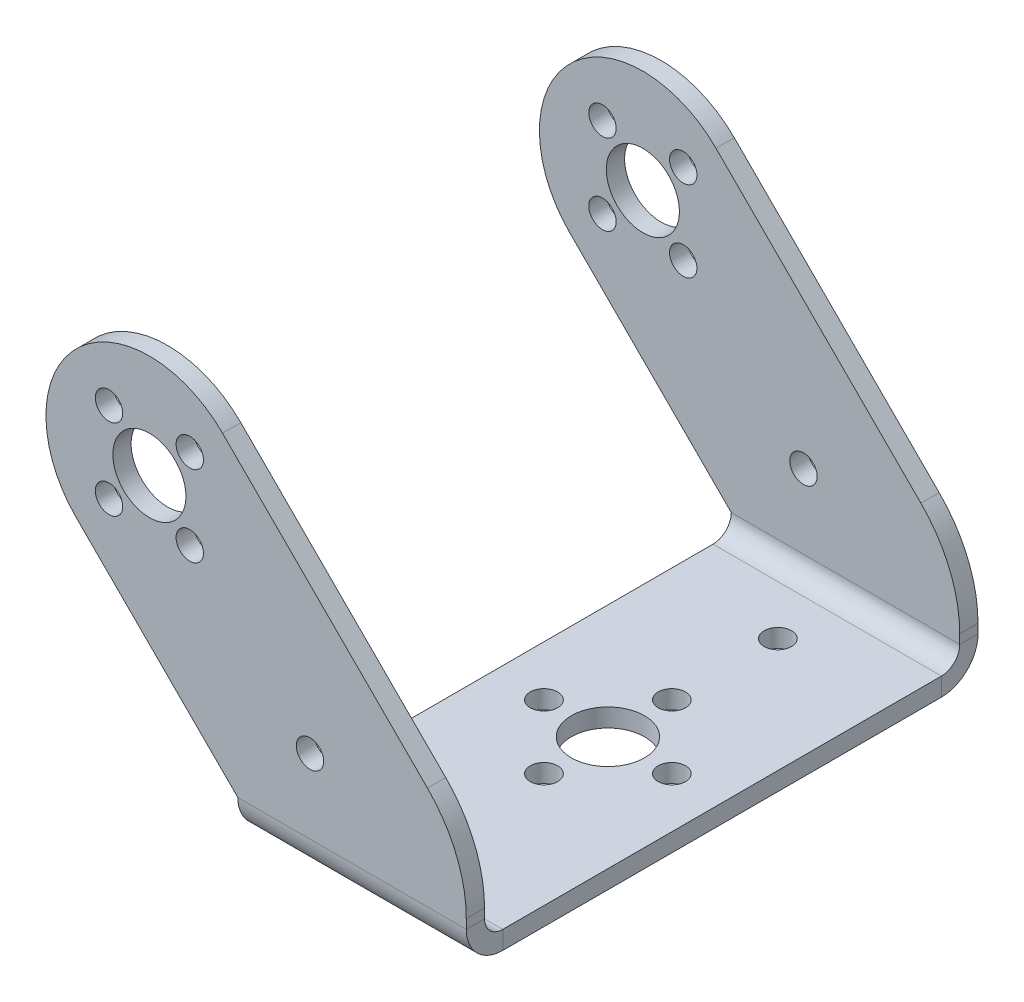
from build123d import *

# Parameters (mm, degrees)
BASE_FLANGE1_DEPTH    = 2
EDGE_FLANGE1_DEPTH    = 25
SKETCH19_R            = 4
CUT_EXTRUDE2_DEPTH    = 58.225619191
M3X0_5_TAPPED_HOLE1_D = 3
SKETCH22_R            = 4
CUT_EXTRUDE3_DEPTH    = 77.018231312
M3X0_5_TAPPED_HOLE2_D = 3


# Sheet-metal steps are written as plain solids
with BuildPart() as part:
    # Sketch8 → Base-Flange1 (new body)
    with BuildSketch(Plane.XY):
        with BuildLine():
            Line((-12.5, 0), (12.5, 0))
            Line((12.5, 0), (12.5, 1.008188695))
            ThreePointArc((12.5, 1.008188695), (11.396253221, 6.557098465), (8.253048327, 11.261237023))
            Line((8.253048327, 11.261237023), (-14.170526855, 33.684812205))
            ThreePointArc((-14.170526855, 33.684812205), (-30.17766953, 33.684812205), (-30.17766953, 17.67766953))
            Line((-30.17766953, 17.67766953), (-12.5, 0))
        make_face()
    extrude(amount=-BASE_FLANGE1_DEPTH)

    # Edge-Flange1 section (across the edge) → Edge-Flange1 (add)
    with BuildSketch(Plane(origin=(12.5, -2, -2), x_dir=(0, 1, 0), z_dir=(-1, 0, 0))):
        with BuildLine():
            Line((-2, 2), (-2, 26))
            Line((-2, 26), (0, 26))
            Line((0, 26), (0, 2))
            ThreePointArc((0, 2), (0.585786438, 0.585786438), (2, 0))
            Line((2, 0), (2, -2))
            ThreePointArc((2, -2), (-0.828427125, -0.828427125), (-2, 2))
        make_face()
    extrude(amount=EDGE_FLANGE1_DEPTH)

    # Sketch19 → Cut-Extrude2 (cut, through all)
    with BuildSketch(Plane.XY):
        with Locations((-22.174098192, 25.681240867)):
            Circle(SKETCH19_R)
    extrude(amount=-CUT_EXTRUDE2_DEPTH, mode=Mode.SUBTRACT)

    # M3x0.5 Tapped Hole1 (through all)
    with Locations(Plane.XY):
        with Locations((-26.593515575, 30.10065825), (-26.593515575, 21.261823485), (-17.75468081, 21.261823485), (-17.75468081, 30.10065825), (-4.60249468, 8.109637355)):
            Hole(M3X0_5_TAPPED_HOLE1_D / 2)

    # Mirror1: part across plane


with BuildPart() as part_1:
    add(part.part)
    add(part.part.mirror(Plane(origin=(12.5, -4, -28), x_dir=(1, 0, 0), z_dir=(0, 0, 1))))

    # Sketch22 → Cut-Extrude3 (cut, through all)
    with BuildSketch(Plane(origin=(0, -2, 0), x_dir=(1, 0, 0), z_dir=(0, 1, 0))):
        with Locations(Location((0, 28, 0), (0, 0, 270))):
            Circle(SKETCH22_R)
    extrude(amount=-CUT_EXTRUDE3_DEPTH, mode=Mode.SUBTRACT)

    # M3x0.5 Tapped Hole2 (through all)
    with Locations(Plane(origin=(0, -2, 0), x_dir=(1, 0, 0), z_dir=(0, 1, 0))):
        with Locations((7, 28), (-7, 28), (0, 35), (0, 21), (0, 9.4), (0, 46.6)):
            Hole(M3X0_5_TAPPED_HOLE2_D / 2)


solid = part_1.part
